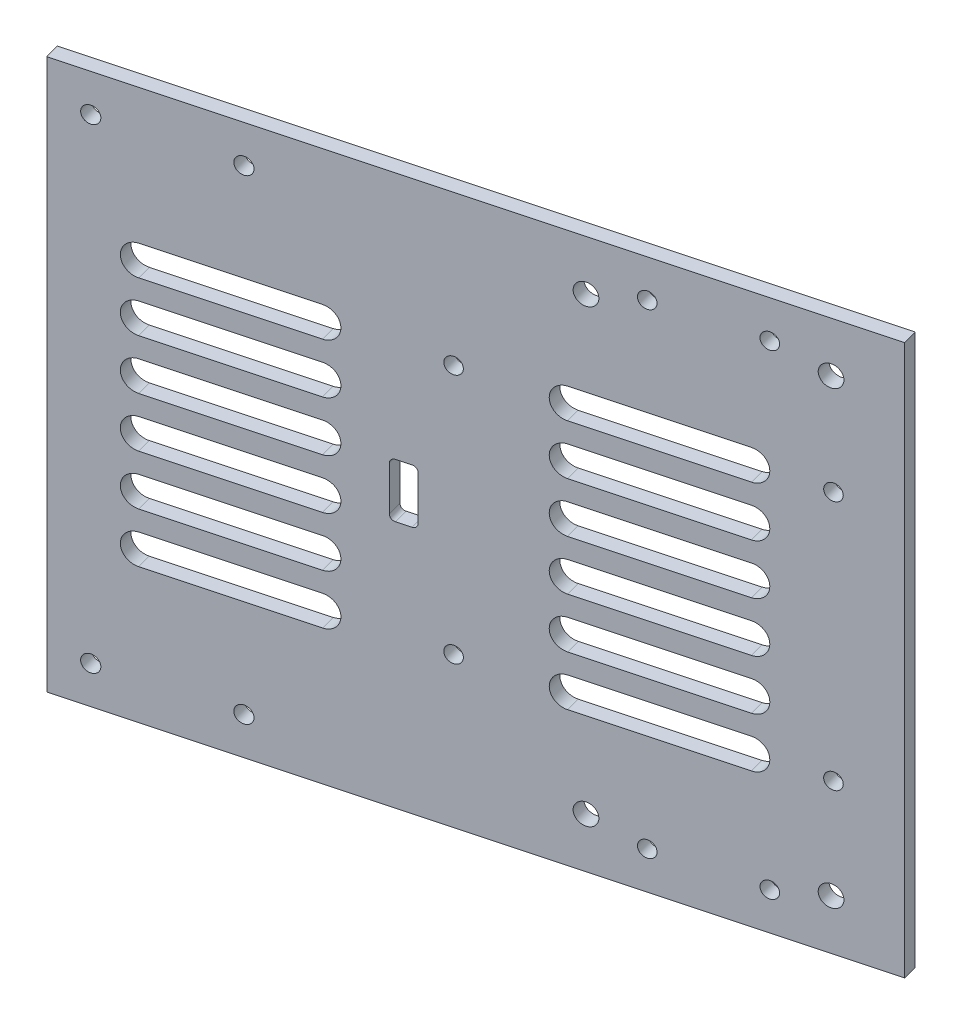
from build123d import *

# Parameters (mm, degrees)
SKETCH2_W          = 140
SKETCH2_H          = 110
SKETCH2_R          = 1.600000003
SKETCH2_R_2        = 2.100000003
EXTRUDE1_DEPTH     = 3
SKETCH4_R          = 1.6
CUT_EXTRUDE2_DEPTH = 10
EXTRUDE2_DEPTH     = 10


with BuildPart() as part:
    # Sketch2 → Extrude1 (new body)
    with BuildSketch(Plane(origin=(-8.535929163, 0, -31.856521324), x_dir=(0.9659258262890755, 0, -0.2588190451024938), z_dir=(0.2588190451024938, 0, 0.9659258262890756))):
        with Locations((118.519484346, 45.004395502)):
            Rectangle(SKETCH2_W, SKETCH2_H)
        with Locations((166.519484344, 92.5043955)):
            Circle(SKETCH2_R, mode=Mode.SUBTRACT)
        with Locations((146.519484344, 92.5043955)):
            Circle(SKETCH2_R, mode=Mode.SUBTRACT)
        with Locations((146.519484344, -2.4956045)):
            Circle(SKETCH2_R, mode=Mode.SUBTRACT)
        with Locations((166.519484344, -2.4956045)):
            Circle(SKETCH2_R, mode=Mode.SUBTRACT)
        with Locations((176.519484344, 0.0043955)):
            Circle(SKETCH2_R_2, mode=Mode.SUBTRACT)
        with Locations((136.519484344, 0.0043955)):
            Circle(SKETCH2_R_2, mode=Mode.SUBTRACT)
        with Locations((176.519484344, 90.0043955)):
            Circle(SKETCH2_R_2, mode=Mode.SUBTRACT)
        with Locations((136.519484344, 90.0043955)):
            Circle(SKETCH2_R_2, mode=Mode.SUBTRACT)
        with BuildLine():
            ThreePointArc((54.043190493, -2.495604498), (55.693190493, -4.145604498), (57.343190493, -2.495604498))
            ThreePointArc((57.343190493, -2.495604498), (55.693190493, -0.845604498), (54.043190493, -2.495604498))
        make_face(mode=Mode.SUBTRACT)
        with BuildLine():
            ThreePointArc((79.043190493, -2.495604498), (80.693190493, -4.145604498), (82.343190493, -2.495604498))
            ThreePointArc((82.343190493, -2.495604498), (80.693190493, -0.845604498), (79.043190493, -2.495604498))
        make_face(mode=Mode.SUBTRACT)
        with BuildLine():
            ThreePointArc((79.043190493, 92.504395502), (80.693190493, 90.854395502), (82.343190493, 92.504395502))
            ThreePointArc((82.343190493, 92.504395502), (80.693190493, 94.154395502), (79.043190493, 92.504395502))
        make_face(mode=Mode.SUBTRACT)
        with BuildLine():
            ThreePointArc((54.043190493, 92.504395502), (55.693190493, 90.854395502), (57.343190493, 92.504395502))
            ThreePointArc((57.343190493, 92.504395502), (55.693190493, 94.154395502), (54.043190493, 92.504395502))
        make_face(mode=Mode.SUBTRACT)
    extrude(amount=EXTRUDE1_DEPTH)

    # Sketch4 → Cut-Extrude2 (cut)
    with BuildSketch(Plane(origin=(-7.759472027, 0, -28.958743846), x_dir=(0.9659258262890755, 0, -0.2588190451024938), z_dir=(0.2588190451024938, 0, 0.9659258262890756))):
        with Locations((114.909924055, 70.004395502)):
            Circle(SKETCH4_R)
        with Locations((176.909924055, 70.004395502)):
            Circle(SKETCH4_R)
        with Locations((176.909924055, 20.004395502)):
            Circle(SKETCH4_R)
        with Locations((114.909924055, 20.004395502)):
            Circle(SKETCH4_R)
        with BuildLine():
            Line((105.422622132, 39.604395502), (108.122622132, 39.604395502))
            ThreePointArc((108.122622132, 39.604395502), (108.829728913, 39.897288721), (109.122622132, 40.604395502))
            Line((109.122622132, 40.604395502), (109.122622132, 49.404395502))
            ThreePointArc((109.122622132, 49.404395502), (108.829728913, 50.111502283), (108.122622132, 50.404395502))
            Line((108.122622132, 50.404395502), (105.422622132, 50.404395502))
            ThreePointArc((105.422622132, 50.404395502), (104.71551535, 50.111502283), (104.422622132, 49.404395502))
            Line((104.422622132, 49.404395502), (104.422622132, 40.604395502))
            ThreePointArc((104.422622132, 40.604395502), (104.71551535, 39.897288721), (105.422622132, 39.604395502))
        make_face()
    extrude(amount=-CUT_EXTRUDE2_DEPTH, mode=Mode.SUBTRACT)

    # Sketch5 → Extrude2 (cut)
    with BuildSketch(Plane(origin=(-7.759472027, 0, -28.958743846), x_dir=(0.9659258262890755, 0, -0.2588190451024938), z_dir=(0.2588190451024938, 0, 0.9659258262890756))):
        with BuildLine():
            Line((63.519484346, 73.004395502), (93.519484346, 73.004395502))
            ThreePointArc((93.519484346, 73.004395502), (96.519484346, 70.004395502), (93.519484346, 67.004395502))
            Line((93.519484346, 67.004395502), (63.519484346, 67.004395502))
            ThreePointArc((63.519484346, 67.004395502), (60.519484346, 70.004395502), (63.519484346, 73.004395502))
        make_face()
        with BuildLine():
            Line((63.519484346, 63.004395502), (93.519484346, 63.004395502))
            ThreePointArc((93.519484346, 63.004395502), (96.519484346, 60.004395502), (93.519484346, 57.004395502))
            Line((93.519484346, 57.004395502), (63.519484346, 57.004395502))
            ThreePointArc((63.519484346, 57.004395502), (60.519484346, 60.004395502), (63.519484346, 63.004395502))
        make_face()
        with BuildLine():
            Line((63.519484346, 53.004395502), (93.519484346, 53.004395502))
            ThreePointArc((93.519484346, 53.004395502), (96.519484346, 50.004395502), (93.519484346, 47.004395502))
            Line((93.519484346, 47.004395502), (63.519484346, 47.004395502))
            ThreePointArc((63.519484346, 47.004395502), (60.519484346, 50.004395502), (63.519484346, 53.004395502))
        make_face()
        with BuildLine():
            Line((63.519484346, 43.004395502), (93.519484346, 43.004395502))
            ThreePointArc((93.519484346, 43.004395502), (96.519484346, 40.004395502), (93.519484346, 37.004395502))
            Line((93.519484346, 37.004395502), (63.519484346, 37.004395502))
            ThreePointArc((63.519484346, 37.004395502), (60.519484346, 40.004395502), (63.519484346, 43.004395502))
        make_face()
        with BuildLine():
            Line((63.519484346, 33.004395502), (93.519484346, 33.004395502))
            ThreePointArc((93.519484346, 33.004395502), (96.519484346, 30.004395502), (93.519484346, 27.004395502))
            Line((93.519484346, 27.004395502), (63.519484346, 27.004395502))
            ThreePointArc((63.519484346, 27.004395502), (60.519484346, 30.004395502), (63.519484346, 33.004395502))
        make_face()
        with BuildLine():
            Line((63.519484346, 23.004395502), (93.519484346, 23.004395502))
            ThreePointArc((93.519484346, 23.004395502), (96.519484346, 20.004395502), (93.519484346, 17.004395502))
            Line((93.519484346, 17.004395502), (63.519484346, 17.004395502))
            ThreePointArc((63.519484346, 17.004395502), (60.519484346, 20.004395502), (63.519484346, 23.004395502))
        make_face()
        with BuildLine():
            Line((133.519484346, 73.004395502), (163.519484346, 73.004395502))
            ThreePointArc((163.519484346, 73.004395502), (166.519484346, 70.004395502), (163.519484346, 67.004395502))
            Line((163.519484346, 67.004395502), (133.519484346, 67.004395502))
            ThreePointArc((133.519484346, 67.004395502), (130.519484346, 70.004395502), (133.519484346, 73.004395502))
        make_face()
        with BuildLine():
            Line((133.519484346, 63.004395502), (163.519484346, 63.004395502))
            ThreePointArc((163.519484346, 63.004395502), (166.519484346, 60.004395502), (163.519484346, 57.004395502))
            Line((163.519484346, 57.004395502), (133.519484346, 57.004395502))
            ThreePointArc((133.519484346, 57.004395502), (130.519484346, 60.004395502), (133.519484346, 63.004395502))
        make_face()
        with BuildLine():
            Line((133.519484346, 53.004395502), (163.519484346, 53.004395502))
            ThreePointArc((163.519484346, 53.004395502), (166.519484346, 50.004395502), (163.519484346, 47.004395502))
            Line((163.519484346, 47.004395502), (133.519484346, 47.004395502))
            ThreePointArc((133.519484346, 47.004395502), (130.519484346, 50.004395502), (133.519484346, 53.004395502))
        make_face()
        with BuildLine():
            Line((133.519484346, 43.004395502), (163.519484346, 43.004395502))
            ThreePointArc((163.519484346, 43.004395502), (166.519484346, 40.004395502), (163.519484346, 37.004395502))
            Line((163.519484346, 37.004395502), (133.519484346, 37.004395502))
            ThreePointArc((133.519484346, 37.004395502), (130.519484346, 40.004395502), (133.519484346, 43.004395502))
        make_face()
        with BuildLine():
            Line((133.519484346, 33.004395502), (163.519484346, 33.004395502))
            ThreePointArc((163.519484346, 33.004395502), (166.519484346, 30.004395502), (163.519484346, 27.004395502))
            Line((163.519484346, 27.004395502), (133.519484346, 27.004395502))
            ThreePointArc((133.519484346, 27.004395502), (130.519484346, 30.004395502), (133.519484346, 33.004395502))
        make_face()
        with BuildLine():
            Line((133.519484346, 23.004395502), (163.519484346, 23.004395502))
            ThreePointArc((163.519484346, 23.004395502), (166.519484346, 20.004395502), (163.519484346, 17.004395502))
            Line((163.519484346, 17.004395502), (133.519484346, 17.004395502))
            ThreePointArc((133.519484346, 17.004395502), (130.519484346, 20.004395502), (133.519484346, 23.004395502))
        make_face()
    extrude(amount=-EXTRUDE2_DEPTH, mode=Mode.SUBTRACT)


solid = part.part
